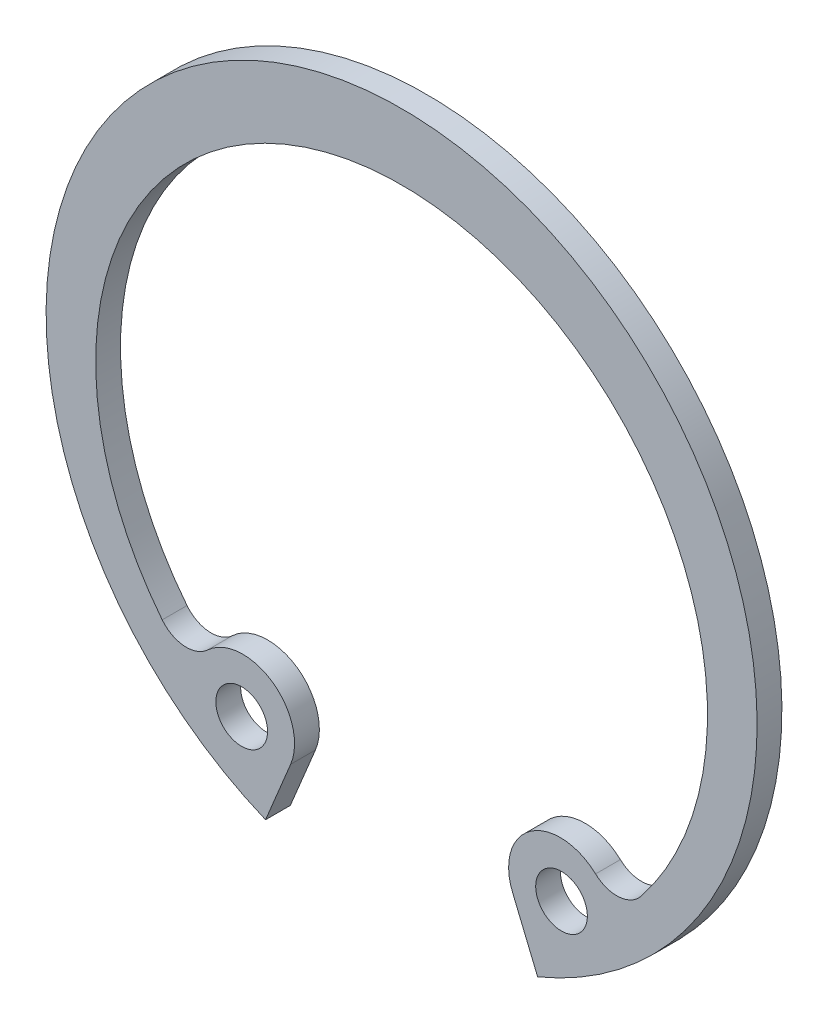
from build123d import *

# Parameters (mm, degrees)
EXTRUDE_1019_DEPTH      = 0.6
EXTRUDE_1019_DEPTH_BACK = 0.6
SKETCH_1_R              = 1.25


with BuildPart() as part:
    # 草图1 → Extrude 1019 (new, two sides: drawn at the far end of the back side and taken through both)
    with BuildSketch(Plane.XY.offset(-EXTRUDE_1019_DEPTH_BACK)):
        with BuildLine():
            Line((-5.368661222, -12.961094733), (-6.582155037, -15.890727959))
            ThreePointArc((-6.582155037, -15.890727959), (0, 17.2), (6.582155037, -15.890727959))
            Line((6.582155037, -15.890727959), (5.368661222, -12.961094733))
            ThreePointArc((5.368661222, -12.961094733), (6.253914741, -9.949889729), (9.384328678, -10.176909463))
            ThreePointArc((9.384328678, -10.176909463), (10.518604236, -10.576333458), (11.581734272, -10.014305793))
            ThreePointArc((11.581734272, -10.014305793), (0, 14), (-11.581734272, -10.014305793))
            ThreePointArc((-11.581734272, -10.014305793), (-10.518604236, -10.576333458), (-9.384328678, -10.176909463))
            ThreePointArc((-9.384328678, -10.176909463), (-6.253914741, -9.949889729), (-5.368661222, -12.961094733))
        make_face()
        with Locations((-7.736657244, -12.145128022)):
            Circle(SKETCH_1_R, mode=Mode.SUBTRACT)
        with Locations((7.736657244, -12.145128022)):
            Circle(SKETCH_1_R, mode=Mode.SUBTRACT)
    extrude(amount=EXTRUDE_1019_DEPTH + EXTRUDE_1019_DEPTH_BACK)


solid = part.part
